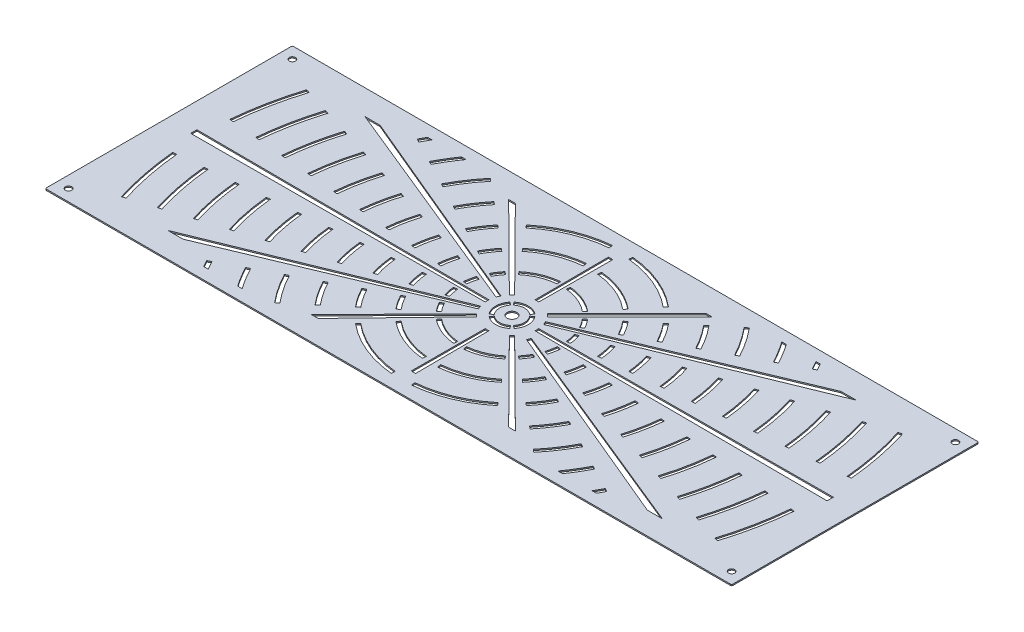
from build123d import *

# Parameters (mm, degrees)
SKETCH2_W                    = 550
SKETCH2_H                    = 198
BASE_FLANGE1_DEPTH           = 1
SKETCH7_R                    = 2.5
CUT_EXTRUDE1_DEPTH           = 293.278976322
ESQUISSE21_R                 = 4
ENL_V_MAT_EXTRU_2_DEPTH      = 10
ENL_V_MAT_EXTRU_3_DEPTH      = 293.278976322
ENL_V_MAT_EXTRU_4_DEPTH      = 293.278976322
R_P_TITION_CIRCULAIRE1_COUNT = 2
SYM_TRIE1_COPY_1_DEPTH       = 293.278976322
CONG_1_R                     = 1


# Sheet-metal steps are written as plain solids
with BuildPart() as part:
    # Sketch2 → Base-Flange1 (new body)
    with BuildSketch(Plane(origin=(0, 0, 0), x_dir=(1, 0, 0), z_dir=(0, 1, 0))):
        Rectangle(SKETCH2_W, SKETCH2_H)
    extrude(amount=-BASE_FLANGE1_DEPTH)

    # Sketch7 → Cut-Extrude1 (cut, through all)
    with BuildSketch(Plane(origin=(0, 0, 0), x_dir=(1, 0, 0), z_dir=(0, 1, 0))):
        with Locations(Location((-265.666666633, 89.66666667, 0), (0, 0, 270))):
            Circle(SKETCH7_R)
        with Locations(Location((-265.666666633, -89.666666667, 0), (0, 0, 270))):
            Circle(SKETCH7_R)
        with Locations(Location((265.666666667, -89.666666667, 0), (0, 0, 270))):
            Circle(SKETCH7_R)
        with Locations(Location((265.666666667, 89.66666667, 0), (0, 0, 270))):
            Circle(SKETCH7_R)
    extrude(amount=-CUT_EXTRUDE1_DEPTH, mode=Mode.SUBTRACT)

    # Esquisse21 → Enlèv. mat.-Extru.2 (cut)
    with BuildSketch(Plane(origin=(0, 0, 0), x_dir=(1, 0, 0), z_dir=(0, 1, 0))):
        Polygon((20, 1.5), (20, -1.5), (255, -2.525387443), (255, 2.525387443), align=None)
        with BuildLine():
            Line((6.427876097, 7.660444431), (8.356238926, 9.958577761))
            ThreePointArc((8.356238926, 9.958577761), (0, 13), (-8.356238926, 9.958577761))
            Line((-8.356238926, 9.958577761), (-6.427876097, 7.660444431))
            ThreePointArc((-6.427876097, 7.660444431), (0, 10), (6.427876097, 7.660444431))
        make_face()
        with BuildLine():
            ThreePointArc((9.958577761, -8.356238926), (13, 0), (9.958577761, 8.356238926))
            Line((9.958577761, 8.356238926), (7.660444431, 6.427876097))
            ThreePointArc((7.660444431, 6.427876097), (10, 0), (7.660444431, -6.427876097))
            Line((7.660444431, -6.427876097), (9.958577761, -8.356238926))
        make_face()
        with Locations(Location((0, 0, 0), (0, 0, 270))):
            Circle(ESQUISSE21_R)
        with BuildLine():
            ThreePointArc((-8.356238926, -9.958577761), (0, -13), (8.356238926, -9.958577761))
            Line((8.356238926, -9.958577761), (6.427876097, -7.660444431))
            ThreePointArc((6.427876097, -7.660444431), (0, -10), (-6.427876097, -7.660444431))
            Line((-6.427876097, -7.660444431), (-8.356238926, -9.958577761))
        make_face()
        with BuildLine():
            ThreePointArc((-9.958577761, 8.356238926), (-13, 0), (-9.958577761, -8.356238926))
            Line((-9.958577761, -8.356238926), (-7.660444431, -6.427876097))
            ThreePointArc((-7.660444431, -6.427876097), (-10, 0), (-7.660444431, 6.427876097))
            Line((-7.660444431, 6.427876097), (-9.958577761, 8.356238926))
        make_face()
        Polygon((-1.757437698, 79), (-1.5, 20), (1.5, 20), (1.757437698, 79), align=None)
        Polygon((-255.000027047, 2.525081253), (-255.000020982, -2.525693633), (-20.000022214, -1.500024015), (-20.000025816, 1.499975985), align=None)
        Polygon((1.5, -19.999998199), (-1.5, -20.000001801), (-1.757366854, -79.00000211), (1.757508542, -78.99999789), align=None)
        Polygon((-81.687072703, 79), (-15.202795796, 13.081475452), (-13.081475452, 15.202795796), (-76.312927297, 79), align=None)
        Polygon((15.202795796, -13.081475451), (13.081475453, -15.202795795), (76.312927297, -79), (81.687072703, -79), align=None)
        Polygon((76.312927297, 79), (13.081475452, 15.202795796), (15.202795796, 13.081475452), (81.687072703, 79), align=None)
        Polygon((-80.801502843, -79.912463595), (-75.427853019, -79.839481382), (-13.068613793, -15.189461661), (-15.218546568, -13.097144987), align=None)
    extrude(amount=-ENL_V_MAT_EXTRU_2_DEPTH, mode=Mode.SUBTRACT)

    # Esquisse36 → Enlèv. mat.-Extru.3 (cut, through all)
    with BuildSketch(Plane(origin=(0, 0, 0), x_dir=(1, 0, 0), z_dir=(0, 1, 0))):
        Polygon((-184.679337782, -79), (-17.903565502, -9.039487946), (-19.051615799, -6.267849349), (-196.766405073, -79), align=None)
        Polygon((-184.679337782, 79), (-196.766405073, 79), (-19.051615799, 6.267849349), (-17.903565502, 9.039487946), align=None)
        Polygon((19.051615799, 6.267849349), (196.766405073, 79), (184.679337782, 79), (17.903565502, 9.039487946), align=None)
        Polygon((201.535227135, -80.99785228), (23.807517077, -8.297280463), (22.659959283, -11.069123011), (189.448160034, -81), align=None)
    extrude(amount=-ENL_V_MAT_EXTRU_3_DEPTH, mode=Mode.SUBTRACT)

    # Esquisse37 → Enlèv. mat.-Extru.4 (cut, through all)
    with BuildSketch(Plane(origin=(0, 0, 0), x_dir=(1, 0, 0), z_dir=(0, 1, 0))):
        with BuildLine():
            ThreePointArc((62.791645915, 5.769741724), (61.843760594, 12.305689413), (60.2174571, 18.706645257))
            Line((60.2174571, 18.706645257), (63.082400659, 19.596644361))
            ThreePointArc((63.082400659, 19.596644361), (64.786078189, 12.891152621), (65.779060698, 6.04424658))
            Line((65.779060698, 6.04424658), (62.791645915, 5.769741724))
        make_face()
        with BuildLine():
            ThreePointArc((39.888132581, 3.665204495), (39.285992363, 7.81713815), (38.252889815, 11.883318796))
            Line((38.252889815, 11.883318796), (41.117833374, 12.7733179))
            ThreePointArc((41.117833374, 12.7733179), (42.228309958, 8.402601358), (42.875547364, 3.939709351))
            Line((42.875547364, 3.939709351), (39.888132581, 3.665204495))
        make_face()
        with BuildLine():
            ThreePointArc((85.69515925, 7.874278953), (84.401528825, 16.794240676), (82.182024385, 25.529971718))
            Line((82.182024385, 25.529971718), (85.046967944, 26.419970821))
            ThreePointArc((85.046967944, 26.419970821), (87.34384642, 17.379703884), (88.682574032, 8.148783809))
            Line((88.682574032, 8.148783809), (85.69515925, 7.874278953))
        make_face()
        with BuildLine():
            ThreePointArc((108.598672584, 9.978816183), (106.959297056, 21.282791938), (104.146591669, 32.353298178))
            Line((104.146591669, 32.353298178), (107.011535228, 33.243297282))
            ThreePointArc((107.011535228, 33.243297282), (109.901614651, 21.868255146), (111.586087367, 10.253321039))
            Line((111.586087367, 10.253321039), (108.598672584, 9.978816183))
        make_face()
        with BuildLine():
            ThreePointArc((76.153410978, 40.078954381), (71.547806368, 47.818155462), (66.158610293, 55.033652178))
            Line((66.158610293, 55.033652178), (68.464962392, 56.952177652))
            ThreePointArc((68.464962392, 56.952177652), (74.042030969, 49.485141856), (78.808191338, 41.476144862))
            Line((78.808191338, 41.476144862), (76.153410978, 40.078954381))
        make_face()
        with BuildLine():
            ThreePointArc((96.50672707, 50.790748071), (90.670194978, 60.598384483), (83.84064305, 69.742347482))
            Line((83.84064305, 69.742347482), (86.146995149, 71.660872957))
            ThreePointArc((86.146995149, 71.660872957), (93.16441958, 62.265370877), (99.16150743, 52.187938552))
            Line((99.16150743, 52.187938552), (96.50672707, 50.790748071))
        make_face()
        with BuildLine():
            ThreePointArc((131.502185918, 12.083353412), (129.517065287, 25.771343201), (126.111158954, 39.176624639))
            Line((126.111158954, 39.176624639), (128.976102513, 40.066623742))
            ThreePointArc((128.976102513, 40.066623742), (132.459382882, 26.356806409), (134.489600701, 12.357858268))
            Line((134.489600701, 12.357858268), (131.502185918, 12.083353412))
        make_face()
        with BuildLine():
            ThreePointArc((154.405699252, 14.187890641), (152.074833518, 30.259894463), (148.075726239, 45.9999511))
            Line((148.075726239, 45.9999511), (150.940669798, 46.889950203))
            ThreePointArc((150.940669798, 46.889950203), (155.017151113, 30.845357672), (157.393114035, 14.462395497))
            Line((157.393114035, 14.462395497), (154.405699252, 14.187890641))
        make_face()
        with BuildLine():
            ThreePointArc((177.309212587, 16.29242787), (174.632601749, 34.748445726), (170.040293524, 52.82327756))
            Line((170.040293524, 52.82327756), (172.905237083, 53.713276664))
            ThreePointArc((172.905237083, 53.713276664), (177.574919344, 35.333908934), (180.296627369, 16.566932726))
            Line((180.296627369, 16.566932726), (177.309212587, 16.29242787))
        make_face()
        with BuildLine():
            ThreePointArc((200.212725921, 18.3969651), (197.19036998, 39.236996989), (192.004860809, 59.646604021))
            Line((192.004860809, 59.646604021), (194.869804368, 60.536603124))
            ThreePointArc((194.869804368, 60.536603124), (200.132687575, 39.822460197), (203.200140703, 18.671469956))
            Line((203.200140703, 18.671469956), (200.212725921, 18.3969651))
        make_face()
        with BuildLine():
            ThreePointArc((55.021691724, 66.168557697), (32.928677834, 79.507023362), (7.874278953, 85.69515925))
            Line((7.874278953, 85.69515925), (8.148783809, 88.682574032))
            ThreePointArc((8.148783809, 88.682574032), (34.076602872, 82.278713841), (56.939800245, 68.475256572))
            Line((56.939800245, 68.475256572), (55.021691724, 66.168557697))
        make_face()
        with BuildLine():
            Line((101.522675808, 84.451042787), (103.829027907, 86.369568261))
            ThreePointArc((103.829027907, 86.369568261), (112.28680819, 75.045599899), (119.514823522, 62.899732242))
            Line((119.514823522, 62.899732242), (116.860043162, 61.50254176))
            ThreePointArc((116.860043162, 61.50254176), (109.792583588, 73.378613505), (101.522675808, 84.451042787))
        make_face()
        with BuildLine():
            Line((137.213359255, 72.21433545), (139.868139614, 73.611525931))
            ThreePointArc((139.868139614, 73.611525931), (135.252539712, 81.783272926), (130.160063451, 89.66666667))
            Line((130.160063451, 89.66666667), (126.50021775, 89.66666667))
            ThreePointArc((126.50021775, 89.66666667), (132.145218, 81.11755397), (137.213359255, 72.21433545))
        make_face()
        with BuildLine():
            Line((157.566675347, 82.92612914), (160.221455707, 84.323319621))
            ThreePointArc((160.221455707, 84.323319621), (158.779926149, 87.007310915), (157.293439116, 89.66666667))
            Line((157.293439116, 89.66666667), (153.830715276, 89.66666667))
            Line((153.830715276, 89.66666667), (157.566675347, 82.92612914))
        make_face()
        with BuildLine():
            ThreePointArc((223.116239255, 20.501502329), (219.748138211, 43.725548251), (213.969428094, 66.469930482))
            Line((213.969428094, 66.469930482), (216.834371653, 67.359929585))
            ThreePointArc((216.834371653, 67.359929585), (222.690455806, 44.31101146), (226.103654038, 20.776007185))
            Line((226.103654038, 20.776007185), (223.116239255, 20.501502329))
        make_face()
        with BuildLine():
            ThreePointArc((246.019752589, 22.606039558), (242.305906442, 48.214099514), (235.933995379, 73.293256942))
            Line((235.933995379, 73.293256942), (238.798938938, 74.183256046))
            ThreePointArc((238.798938938, 74.183256046), (245.248224037, 48.799562722), (249.007167372, 22.880544414))
            Line((249.007167372, 22.880544414), (246.019752589, 22.606039558))
        make_face()
        with BuildLine():
            ThreePointArc((40.316193057, 48.483866324), (24.127919209, 58.257396363), (5.769741724, 62.791645915))
            Line((5.769741724, 62.791645915), (6.04424658, 65.779060698))
            ThreePointArc((6.04424658, 65.779060698), (25.275844247, 61.029086841), (42.234301579, 50.790565199))
            Line((42.234301579, 50.790565199), (40.316193057, 48.483866324))
        make_face()
        with BuildLine():
            ThreePointArc((3.939709351, 42.875547364), (16.475085623, 39.779459841), (27.528802912, 33.105873825))
            Line((27.528802912, 33.105873825), (25.610694391, 30.79917495))
            ThreePointArc((25.610694391, 30.79917495), (15.327160585, 37.007769363), (3.665204495, 39.888132581))
            Line((3.665204495, 39.888132581), (3.939709351, 42.875547364))
        make_face()
        with BuildLine():
            ThreePointArc((33.100896876, 27.534787043), (35.797253749, 23.924683813), (38.101559153, 20.052557483))
            Line((38.101559153, 20.052557483), (35.446778794, 18.655367002))
            ThreePointArc((35.446778794, 18.655367002), (33.303029148, 22.257697419), (30.794544778, 25.616261568))
            Line((30.794544778, 25.616261568), (33.100896876, 27.534787043))
        make_face()
        with BuildLine():
            Line((48.476577535, 40.324956873), (50.782929634, 42.243482347))
            ThreePointArc((50.782929634, 42.243482347), (54.919642359, 36.704912835), (58.454875246, 30.764351173))
            Line((58.454875246, 30.764351173), (55.800094886, 29.367160691))
            ThreePointArc((55.800094886, 29.367160691), (52.425417758, 35.03792644), (48.476577535, 40.324956873))
        make_face()
    enl_v_mat_extru_4 = extrude(amount=-ENL_V_MAT_EXTRU_4_DEPTH, mode=Mode.SUBTRACT)

    # Répétition circulaire1: Enlèv. mat.-Extru.4 ×2 about axis
    r_p_tition_circulaire1_axis = Axis((0, 0, 0), (0, 1, 0))
    for i in range(1, R_P_TITION_CIRCULAIRE1_COUNT):
        add(enl_v_mat_extru_4.rotate(r_p_tition_circulaire1_axis, i * 360 / R_P_TITION_CIRCULAIRE1_COUNT), mode=Mode.SUBTRACT)

    # Symétrie1: Enlèv. mat.-Extru.4 across plane
    add(enl_v_mat_extru_4.mirror(Plane.XY), mode=Mode.SUBTRACT)

    # Symétrie1 copy 1 sketch → Symétrie1 copy 1 (cut, through all)
    with BuildSketch(Plane(origin=(0, 0, 0), x_dir=(-1, 0, 0), z_dir=(0, 1, 0))):
        with BuildLine():
            ThreePointArc((62.791645915, -5.769741724), (61.843760594, -12.305689413), (60.2174571, -18.706645257))
            Line((60.2174571, -18.706645257), (63.082400659, -19.596644361))
            ThreePointArc((63.082400659, -19.596644361), (64.786078189, -12.891152621), (65.779060698, -6.04424658))
            Line((65.779060698, -6.04424658), (62.791645915, -5.769741724))
        make_face()
        with BuildLine():
            ThreePointArc((39.888132581, -3.665204495), (39.285992363, -7.81713815), (38.252889815, -11.883318796))
            Line((38.252889815, -11.883318796), (41.117833374, -12.7733179))
            ThreePointArc((41.117833374, -12.7733179), (42.228309958, -8.402601358), (42.875547364, -3.939709351))
            Line((42.875547364, -3.939709351), (39.888132581, -3.665204495))
        make_face()
        with BuildLine():
            ThreePointArc((85.69515925, -7.874278953), (84.401528825, -16.794240676), (82.182024385, -25.529971718))
            Line((82.182024385, -25.529971718), (85.046967944, -26.419970821))
            ThreePointArc((85.046967944, -26.419970821), (87.34384642, -17.379703884), (88.682574032, -8.148783809))
            Line((88.682574032, -8.148783809), (85.69515925, -7.874278953))
        make_face()
        with BuildLine():
            ThreePointArc((108.598672584, -9.978816183), (106.959297056, -21.282791938), (104.146591669, -32.353298178))
            Line((104.146591669, -32.353298178), (107.011535228, -33.243297282))
            ThreePointArc((107.011535228, -33.243297282), (109.901614651, -21.868255146), (111.586087367, -10.253321039))
            Line((111.586087367, -10.253321039), (108.598672584, -9.978816183))
        make_face()
        with BuildLine():
            ThreePointArc((76.153410978, -40.078954381), (71.547806368, -47.818155462), (66.158610293, -55.033652178))
            Line((66.158610293, -55.033652178), (68.464962392, -56.952177652))
            ThreePointArc((68.464962392, -56.952177652), (74.042030969, -49.485141856), (78.808191338, -41.476144862))
            Line((78.808191338, -41.476144862), (76.153410978, -40.078954381))
        make_face()
        with BuildLine():
            ThreePointArc((96.50672707, -50.790748071), (90.670194978, -60.598384483), (83.84064305, -69.742347482))
            Line((83.84064305, -69.742347482), (86.146995149, -71.660872957))
            ThreePointArc((86.146995149, -71.660872957), (93.16441958, -62.265370877), (99.16150743, -52.187938552))
            Line((99.16150743, -52.187938552), (96.50672707, -50.790748071))
        make_face()
        with BuildLine():
            ThreePointArc((131.502185918, -12.083353412), (129.517065287, -25.771343201), (126.111158954, -39.176624639))
            Line((126.111158954, -39.176624639), (128.976102513, -40.066623742))
            ThreePointArc((128.976102513, -40.066623742), (132.459382882, -26.356806409), (134.489600701, -12.357858268))
            Line((134.489600701, -12.357858268), (131.502185918, -12.083353412))
        make_face()
        with BuildLine():
            ThreePointArc((154.405699252, -14.187890641), (152.074833518, -30.259894463), (148.075726239, -45.9999511))
            Line((148.075726239, -45.9999511), (150.940669798, -46.889950203))
            ThreePointArc((150.940669798, -46.889950203), (155.017151113, -30.845357672), (157.393114035, -14.462395497))
            Line((157.393114035, -14.462395497), (154.405699252, -14.187890641))
        make_face()
        with BuildLine():
            ThreePointArc((177.309212587, -16.29242787), (174.632601749, -34.748445726), (170.040293524, -52.82327756))
            Line((170.040293524, -52.82327756), (172.905237083, -53.713276664))
            ThreePointArc((172.905237083, -53.713276664), (177.574919344, -35.333908934), (180.296627369, -16.566932726))
            Line((180.296627369, -16.566932726), (177.309212587, -16.29242787))
        make_face()
        with BuildLine():
            ThreePointArc((200.212725921, -18.3969651), (197.19036998, -39.236996989), (192.004860809, -59.646604021))
            Line((192.004860809, -59.646604021), (194.869804368, -60.536603124))
            ThreePointArc((194.869804368, -60.536603124), (200.132687575, -39.822460197), (203.200140703, -18.671469956))
            Line((203.200140703, -18.671469956), (200.212725921, -18.3969651))
        make_face()
        with BuildLine():
            ThreePointArc((55.021691724, -66.168557697), (32.928677834, -79.507023362), (7.874278953, -85.69515925))
            Line((7.874278953, -85.69515925), (8.148783809, -88.682574032))
            ThreePointArc((8.148783809, -88.682574032), (34.076602872, -82.278713841), (56.939800245, -68.475256572))
            Line((56.939800245, -68.475256572), (55.021691724, -66.168557697))
        make_face()
        with BuildLine():
            Line((101.522675808, -84.451042787), (103.829027907, -86.369568261))
            ThreePointArc((103.829027907, -86.369568261), (112.28680819, -75.045599899), (119.514823522, -62.899732242))
            Line((119.514823522, -62.899732242), (116.860043162, -61.50254176))
            ThreePointArc((116.860043162, -61.50254176), (109.792583588, -73.378613505), (101.522675808, -84.451042787))
        make_face()
        with BuildLine():
            Line((137.213359255, -72.21433545), (139.868139614, -73.611525931))
            ThreePointArc((139.868139614, -73.611525931), (135.252539712, -81.783272926), (130.160063451, -89.66666667))
            Line((130.160063451, -89.66666667), (126.50021775, -89.66666667))
            ThreePointArc((126.50021775, -89.66666667), (132.145218, -81.11755397), (137.213359255, -72.21433545))
        make_face()
        with BuildLine():
            Line((157.566675347, -82.92612914), (160.221455707, -84.323319621))
            ThreePointArc((160.221455707, -84.323319621), (158.779926149, -87.007310915), (157.293439116, -89.66666667))
            Line((157.293439116, -89.66666667), (153.830715276, -89.66666667))
            Line((153.830715276, -89.66666667), (157.566675347, -82.92612914))
        make_face()
        with BuildLine():
            ThreePointArc((223.116239255, -20.501502329), (219.748138211, -43.725548251), (213.969428094, -66.469930482))
            Line((213.969428094, -66.469930482), (216.834371653, -67.359929585))
            ThreePointArc((216.834371653, -67.359929585), (222.690455806, -44.31101146), (226.103654038, -20.776007185))
            Line((226.103654038, -20.776007185), (223.116239255, -20.501502329))
        make_face()
        with BuildLine():
            ThreePointArc((246.019752589, -22.606039558), (242.305906442, -48.214099514), (235.933995379, -73.293256942))
            Line((235.933995379, -73.293256942), (238.798938938, -74.183256046))
            ThreePointArc((238.798938938, -74.183256046), (245.248224037, -48.799562722), (249.007167372, -22.880544414))
            Line((249.007167372, -22.880544414), (246.019752589, -22.606039558))
        make_face()
        with BuildLine():
            ThreePointArc((40.316193057, -48.483866324), (24.127919209, -58.257396363), (5.769741724, -62.791645915))
            Line((5.769741724, -62.791645915), (6.04424658, -65.779060698))
            ThreePointArc((6.04424658, -65.779060698), (25.275844247, -61.029086841), (42.234301579, -50.790565199))
            Line((42.234301579, -50.790565199), (40.316193057, -48.483866324))
        make_face()
        with BuildLine():
            ThreePointArc((3.939709351, -42.875547364), (16.475085623, -39.779459841), (27.528802912, -33.105873825))
            Line((27.528802912, -33.105873825), (25.610694391, -30.79917495))
            ThreePointArc((25.610694391, -30.79917495), (15.327160585, -37.007769363), (3.665204495, -39.888132581))
            Line((3.665204495, -39.888132581), (3.939709351, -42.875547364))
        make_face()
        with BuildLine():
            ThreePointArc((33.100896876, -27.534787043), (35.797253749, -23.924683813), (38.101559153, -20.052557483))
            Line((38.101559153, -20.052557483), (35.446778794, -18.655367002))
            ThreePointArc((35.446778794, -18.655367002), (33.303029148, -22.257697419), (30.794544778, -25.616261568))
            Line((30.794544778, -25.616261568), (33.100896876, -27.534787043))
        make_face()
        with BuildLine():
            Line((48.476577535, -40.324956873), (50.782929634, -42.243482347))
            ThreePointArc((50.782929634, -42.243482347), (54.919642359, -36.704912835), (58.454875246, -30.764351173))
            Line((58.454875246, -30.764351173), (55.800094886, -29.367160691))
            ThreePointArc((55.800094886, -29.367160691), (52.425417758, -35.03792644), (48.476577535, -40.324956873))
        make_face()
    extrude(amount=-SYM_TRIE1_COPY_1_DEPTH, mode=Mode.SUBTRACT)

    # Congé1
    cong_1_edges = [part.edges().sort_by_distance(p)[0] for p in [
        (275, -0.5, 99),
        (-275, -0.5, 99),
        (-275, -0.5, -99),
        (275, -0.5, -99),
    ]]
    fillet(cong_1_edges, radius=CONG_1_R)


solid = part.part
